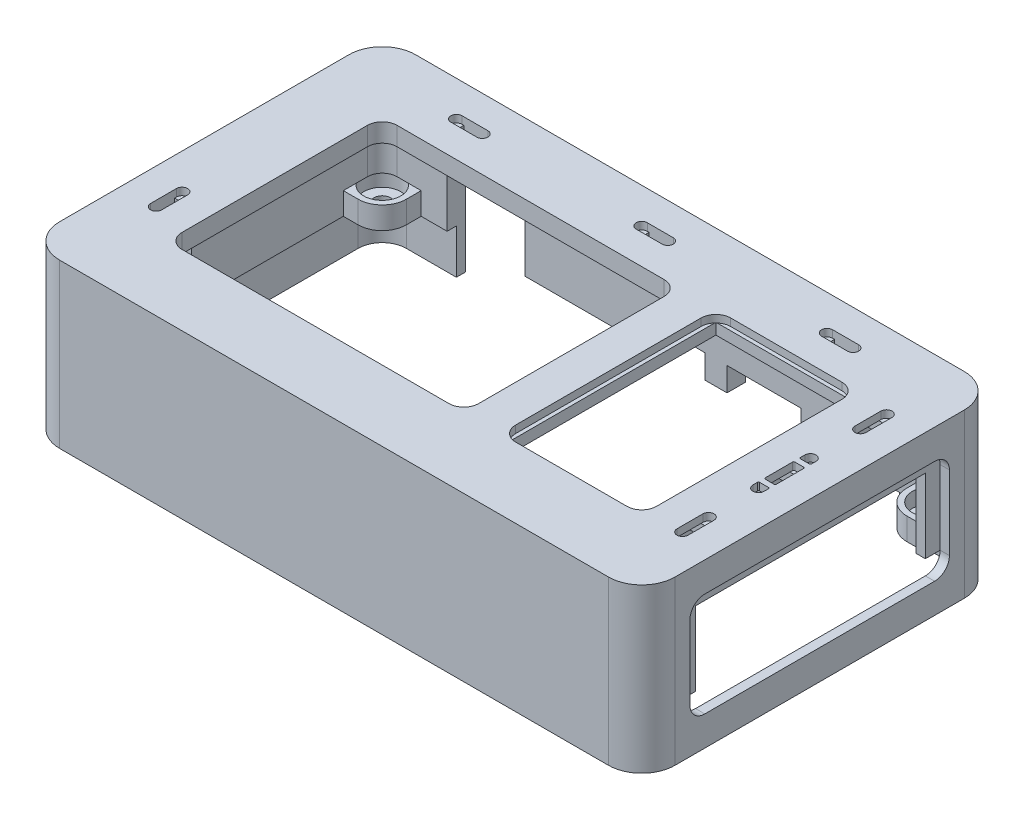
from build123d import *

# Parameters (mm, degrees)
EXTRUDE_1_DEPTH      = 22
CUT_EXTRUDE_1_DEPTH  = 19.5
CUT_EXTRUDE_2_DEPTH  = 1
CUT_EXTRUDE_START    = -1.5
SKETCH_6_W           = 3
SKETCH_6_H           = 3
SKETCH_6_H_2         = 2.8
CUT_EXTRUDE_6_DEPTH  = 1.5
CUT_EXTRUDE_7_REACH  = 98.377
CUT_EXTRUDE_8_DEPTH  = 1
CUT_EXTRUDE_9_REACH  = 99.109
CUT_EXTRUDE_START_2  = -6
CUT_EXTRUDE_10_DEPTH = 6
EXTRUDE_START        = -3
SKETCH_12_R          = 1.1
EXTRUDE_3_DEPTH      = 3
CUT_EXTRUDE_14_REACH = 99.649
SKETCH_17_W          = 31
SKETCH_17_H          = 10
CUT_EXTRUDE_15_DEPTH = 1.25
CUT_EXTRUDE_16_REACH = 97.898
SKETCH_20_R          = 2.5
CUT_EXTRUDE_17_DEPTH = 2
SKETCH_22_W          = 8
SKETCH_22_H          = 4
CUT_EXTRUDE_18_DEPTH = 1.25
CUT_EXTRUDE_19_REACH = 99.649
SKETCH_24_W          = 10.5
SKETCH_24_H          = 16.2
CUT_EXTRUDE_20_REACH = 97.187
SKETCH_28_W          = 3
SKETCH_28_H          = 8
EXTRUDE_7_DEPTH      = 43
SKETCH_30_W          = 1
SKETCH_30_H          = 8
EXTRUDE_8_DEPTH      = 1
CUT_EXTRUDE_START_3  = -8.5
SKETCH_31_W          = 9
SKETCH_31_H          = 3.2
CUT_EXTRUDE_21_DEPTH = 6
EXTRUDE_9_DEPTH      = 1
CUT_EXTRUDE_START_4  = -1.25
SKETCH_34_W          = 8
SKETCH_34_H          = 1
CUT_EXTRUDE_22_DEPTH = 1.25
EXTRUDE_START_2      = -16
EXTRUDE_10_DEPTH     = 12.5


# Read off the part's stored shape, not the designer's step: 凸台-拉伸10
with BuildPart() as part:
    # 草图1 → 凸台-拉伸1 (new body)
    with BuildSketch(Plane(origin=(0, 0, 0), x_dir=(1, 0, 0), z_dir=(0, 1, 0))):
        with BuildLine():
            Line((3, 1.5), (77, 1.5))
            ThreePointArc((77, 1.5), (80.181980515, 0.181980515), (81.5, -3))
            Line((81.5, -3), (81.5, -42))
            ThreePointArc((81.5, -42), (80.181980515, -45.181980515), (77, -46.5))
            Line((77, -46.5), (3, -46.5))
            ThreePointArc((3, -46.5), (-0.181980515, -45.181980515), (-1.5, -42))
            Line((-1.5, -42), (-1.5, -3))
            ThreePointArc((-1.5, -3), (-0.181980515, 0.181980515), (3, 1.5))
        make_face()
    extrude(amount=-EXTRUDE_1_DEPTH)

    # 草图2 → 切除-拉伸1 (cut)
    with BuildSketch(Plane.XZ.offset(22)):
        with BuildLine():
            Line((3, 1), (77, 1))
            ThreePointArc((77, 1), (78.414213562, 1.585786438), (79, 3))
            Line((79, 3), (79, 42))
            ThreePointArc((79, 42), (78.414213562, 43.414213562), (77, 44))
            Line((77, 44), (3, 44))
            ThreePointArc((3, 44), (1.585786438, 43.414213562), (1, 42))
            Line((1, 42), (1, 3))
            ThreePointArc((1, 3), (1.585786438, 1.585786438), (3, 1))
        make_face()
    extrude(amount=-CUT_EXTRUDE_1_DEPTH, mode=Mode.SUBTRACT)

    # 草图3 → 切除-拉伸2 (cut)
    with BuildSketch(Plane(origin=(0, 0, 0), x_dir=(1, 0, 0), z_dir=(0, 1, 0))):
        with BuildLine():
            Line((63.25, -2.5), (66.75, -2.5))
            ThreePointArc((66.75, -2.5), (67.5, -3.25), (66.75, -4))
            Line((66.75, -4), (63.25, -4))
            ThreePointArc((63.25, -4), (62.5, -3.25), (63.25, -2.5))
        make_face()
        with BuildLine():
            Line((72, -10), (72, -35))
            ThreePointArc((72, -35), (71.414213562, -36.414213562), (70, -37))
            Line((70, -37), (55, -37))
            ThreePointArc((55, -37), (53.585786438, -36.414213562), (53, -35))
            Line((53, -35), (53, -10))
            ThreePointArc((53, -10), (53.585786438, -8.585786438), (55, -8))
            Line((55, -8), (70, -8))
            ThreePointArc((70, -8), (71.414213562, -8.585786438), (72, -10))
        make_face()
        with BuildLine():
            Line((38.25, -2.5), (41.75, -2.5))
            ThreePointArc((41.75, -2.5), (42.5, -3.25), (41.75, -4))
            Line((41.75, -4), (38.25, -4))
            ThreePointArc((38.25, -4), (37.5, -3.25), (38.25, -2.5))
        make_face()
        with BuildLine():
            Line((13.25, -2.5), (16.75, -2.5))
            ThreePointArc((16.75, -2.5), (17.5, -3.25), (16.75, -4))
            Line((16.75, -4), (13.25, -4))
            ThreePointArc((13.25, -4), (12.5, -3.25), (13.25, -2.5))
        make_face()
        with BuildLine():
            Line((76, -19), (76, -19.6))
            ThreePointArc((76, -19.6), (76.043933983, -19.706066017), (76.15, -19.75))
            Line((76.15, -19.75), (77.35, -19.75))
            ThreePointArc((77.35, -19.75), (77.456066017, -19.706066017), (77.5, -19.6))
            Line((77.5, -19.6), (77.5, -19))
            ThreePointArc((77.5, -19), (76.75, -18.25), (76, -19))
        make_face()
        with BuildLine():
            Line((76, -26), (76, -25.4))
            ThreePointArc((76, -25.4), (76.043933983, -25.293933983), (76.15, -25.25))
            Line((76.15, -25.25), (77.35, -25.25))
            ThreePointArc((77.35, -25.25), (77.456066017, -25.293933983), (77.5, -25.4))
            Line((77.5, -25.4), (77.5, -26))
            ThreePointArc((77.5, -26), (76.75, -26.75), (76, -26))
        make_face()
        with BuildLine():
            Line((77.5, -8.75), (77.5, -12.25))
            ThreePointArc((77.5, -12.25), (76.75, -13), (76, -12.25))
            Line((76, -12.25), (76, -8.75))
            ThreePointArc((76, -8.75), (76.75, -8), (77.5, -8.75))
        make_face()
        with BuildLine():
            Line((77.5, -32.75), (77.5, -36.25))
            ThreePointArc((77.5, -36.25), (76.75, -37), (76, -36.25))
            Line((76, -36.25), (76, -32.75))
            ThreePointArc((76, -32.75), (76.75, -32), (77.5, -32.75))
        make_face()
        with BuildLine():
            Line((76.15, -20.5), (77.35, -20.5))
            ThreePointArc((77.35, -20.5), (77.456066017, -20.543933983), (77.5, -20.65))
            Line((77.5, -20.65), (77.5, -24.35))
            ThreePointArc((77.5, -24.35), (77.456066017, -24.456066017), (77.35, -24.5))
            Line((77.35, -24.5), (76.15, -24.5))
            ThreePointArc((76.15, -24.5), (76.043933983, -24.456066017), (76, -24.35))
            Line((76, -24.35), (76, -20.65))
            ThreePointArc((76, -20.65), (76.043933983, -20.543933983), (76.15, -20.5))
        make_face()
        with BuildLine():
            Line((4, -30.25), (4, -33.75))
            ThreePointArc((4, -33.75), (3.25, -34.5), (2.5, -33.75))
            Line((2.5, -33.75), (2.5, -30.25))
            ThreePointArc((2.5, -30.25), (3.25, -29.5), (4, -30.25))
        make_face()
    extrude(amount=-CUT_EXTRUDE_2_DEPTH, mode=Mode.SUBTRACT)

    # 草图6 → 切除-拉伸6 (cut)
    with BuildSketch(Plane.XZ.offset(2.5).offset(CUT_EXTRUDE_START)):
        Polygon((53.5, 36.5), (53.5, 8.5), (71.5, 8.5), (71.5, 36.5), (71.5, 41), (53.5, 41), align=None)
        with Locations((4, 32)):
            Rectangle(SKETCH_6_W, SKETCH_6_H)
        Polygon((13.5, 2.5), (16.5, 2.5), (16.5, 5.5), (16.5, 6.5), (13.5, 6.5), (13.5, 5.5), align=None)
        Polygon((38.5, 5.5), (38.5, 2.5), (41.5, 2.5), (41.5, 5.5), (41.5, 6.5), (38.5, 6.5), align=None)
        Polygon((63.5, 5.5), (63.5, 2.5), (66.5, 2.5), (66.5, 5.5), (66.5, 6.5), (63.5, 6.5), align=None)
        with Locations((76, 10.5)):
            Rectangle(SKETCH_6_W, SKETCH_6_H)
        with Locations((76, 22.5)):
            Rectangle(SKETCH_6_W, SKETCH_6_H)
        with Locations((76, 18.9)):
            Rectangle(SKETCH_6_W, SKETCH_6_H_2)
        with Locations((76, 26.1)):
            Rectangle(SKETCH_6_W, SKETCH_6_H_2)
        with Locations((76, 34.5)):
            Rectangle(SKETCH_6_W, SKETCH_6_H)
    extrude(amount=CUT_EXTRUDE_6_DEPTH, mode=Mode.SUBTRACT)

    # 草图7 → 切除-拉伸7 (cut, up to next)
    with BuildSketch(Plane(origin=(0, 0, 0), x_dir=(1, 0, 0), z_dir=(0, 1, 0)), mode=Mode.PRIVATE) as cut_extrude_7_sk1:
        with BuildLine():
            Line((10, -8), (46, -8))
            ThreePointArc((46, -8), (47.414213562, -8.585786438), (48, -10))
            Line((48, -10), (48, -35))
            ThreePointArc((48, -35), (47.414213562, -36.414213562), (46, -37))
            Line((46, -37), (10, -37))
            ThreePointArc((10, -37), (8.585786438, -36.414213562), (8, -35))
            Line((8, -35), (8, -10))
            ThreePointArc((8, -10), (8.585786438, -8.585786438), (10, -8))
        make_face()
    cut_extrude_7_tool1 = extrude(cut_extrude_7_sk1.sketch, amount=-CUT_EXTRUDE_7_REACH, mode=Mode.PRIVATE) & part.part
    add(cut_extrude_7_tool1.solids().sort_by_distance((28, 0, 22.5))[0], mode=Mode.SUBTRACT)

    # 草图8 → 切除-拉伸8 (cut)
    with BuildSketch(Plane.XZ.offset(2.5)):
        with BuildLine():
            Line((-0.25, 42), (-0.25, 3))
            ThreePointArc((-0.25, 3), (0.701902961, 0.701902961), (3, -0.25))
            Line((3, -0.25), (77, -0.25))
            ThreePointArc((77, -0.25), (79.298097039, 0.701902961), (80.25, 3))
            Line((80.25, 3), (80.25, 42))
            ThreePointArc((80.25, 42), (79.298097039, 44.298097039), (77, 45.25))
            Line((77, 45.25), (3, 45.25))
            ThreePointArc((3, 45.25), (0.701902961, 44.298097039), (-0.25, 42))
        make_face()
    extrude(amount=CUT_EXTRUDE_8_DEPTH, mode=Mode.SUBTRACT)

    # 草图10 → 切除-拉伸9 (cut, up to next)
    with BuildSketch(Plane(origin=(0, 0, -1.5), x_dir=(-1, 0, 0), z_dir=(0, 0, -1)), mode=Mode.PRIVATE) as cut_extrude_9_sk1:
        Polygon((-44.5, -16), (-44.5, -12.8), (-35.5, -12.8), (-35.5, -16), (-20.25, -16), (-20.25, -5.8), (-9.75, -5.8), (-9.75, -16), (-9.75, -22), (-69.5, -22), (-69.5, -16), (-69.5, -12.8), (-60.5, -12.8), (-60.5, -16), (-57.5, -16), (-57.5, -12.8), (-47.5, -12.8), (-47.5, -16), align=None)
    cut_extrude_9_tool1 = extrude(cut_extrude_9_sk1.sketch, amount=-CUT_EXTRUDE_9_REACH, mode=Mode.PRIVATE) & part.part
    add(cut_extrude_9_tool1.solids().sort_by_distance((36.952562, -16.695119, -1.5))[0], mode=Mode.SUBTRACT)

    # 草图11 → 切除-拉伸10 (cut)
    with BuildSketch(Plane.XZ.offset(22).offset(CUT_EXTRUDE_START_2)):
        with BuildLine():
            Line((3, -0.25), (77, -0.25))
            ThreePointArc((77, -0.25), (79.298097039, 0.701902961), (80.25, 3))
            Line((80.25, 3), (80.25, 42))
            ThreePointArc((80.25, 42), (79.298097039, 44.298097039), (77, 45.25))
            Line((77, 45.25), (3, 45.25))
            ThreePointArc((3, 45.25), (0.701902961, 44.298097039), (-0.25, 42))
            Line((-0.25, 42), (-0.25, 3))
            ThreePointArc((-0.25, 3), (0.701902961, 0.701902961), (3, -0.25))
        make_face()
    extrude(amount=CUT_EXTRUDE_10_DEPTH, mode=Mode.SUBTRACT)

    # 草图12 → 凸台-拉伸3 (add)
    # profile 1 of 4: a face of its own
    with BuildSketch(Plane.XZ.offset(16).offset(EXTRUDE_START)):
        with BuildLine():
            Line((6.25, 42), (6.25, 45.25))
            Line((6.25, 45.25), (3, 45.25))
            ThreePointArc((3, 45.25), (0.701902961, 44.298097039), (-0.25, 42))
            Line((-0.25, 42), (-0.25, 38.75))
            Line((-0.25, 38.75), (3, 38.75))
            ThreePointArc((3, 38.75), (5.298097039, 39.701902961), (6.25, 42))
        make_face()
        with Locations(Location((3, 42, 0), (0, 0, 270))):
            Circle(SKETCH_12_R, mode=Mode.SUBTRACT)
    # profile 2 of 4: a face of its own
    with BuildSketch(Plane.XZ.offset(16).offset(EXTRUDE_START)):
        with BuildLine():
            Line((3, 6.25), (-0.25, 6.25))
            Line((-0.25, 6.25), (-0.25, 3))
            ThreePointArc((-0.25, 3), (0.701902961, 0.701902961), (3, -0.25))
            Line((3, -0.25), (6.25, -0.25))
            Line((6.25, -0.25), (6.25, 3))
            ThreePointArc((6.25, 3), (5.298097039, 5.298097039), (3, 6.25))
        make_face()
        with Locations(Location((3, 3, 0), (0, 0, 270))):
            Circle(SKETCH_12_R, mode=Mode.SUBTRACT)
    # profile 3 of 4: a face of its own
    with BuildSketch(Plane.XZ.offset(16).offset(EXTRUDE_START)):
        with BuildLine():
            Line((77, 6.25), (80.25, 6.25))
            Line((80.25, 6.25), (80.25, 3))
            ThreePointArc((80.25, 3), (79.298097039, 0.701902961), (77, -0.25))
            Line((77, -0.25), (73.75, -0.25))
            Line((73.75, -0.25), (73.75, 3))
            ThreePointArc((73.75, 3), (74.701902961, 5.298097039), (77, 6.25))
        make_face()
        with Locations(Location((77, 3, 0), (0, 0, 270))):
            Circle(SKETCH_12_R, mode=Mode.SUBTRACT)
    # profile 4 of 4: a face of its own
    with BuildSketch(Plane.XZ.offset(16).offset(EXTRUDE_START)):
        with BuildLine():
            Line((73.75, 42), (73.75, 45.25))
            Line((73.75, 45.25), (77, 45.25))
            ThreePointArc((77, 45.25), (79.298097039, 44.298097039), (80.25, 42))
            Line((80.25, 42), (80.25, 38.75))
            Line((80.25, 38.75), (77, 38.75))
            ThreePointArc((77, 38.75), (74.701902961, 39.701902961), (73.75, 42))
        make_face()
        with Locations(Location((77, 42, 0), (0, 0, 270))):
            Circle(SKETCH_12_R, mode=Mode.SUBTRACT)
    extrude(amount=EXTRUDE_3_DEPTH)

    # 草图17 → 切除-拉伸14 (cut, up to next)
    with BuildSketch(Plane(origin=(81.5, 0, 0), x_dir=(0, 0, -1), z_dir=(1, 0, 0)), mode=Mode.PRIVATE) as cut_extrude_14_sk1:
        with Locations((-22.5, -11)):
            Rectangle(SKETCH_17_W, SKETCH_17_H)
    cut_extrude_14_tool1 = extrude(cut_extrude_14_sk1.sketch, amount=-CUT_EXTRUDE_14_REACH, mode=Mode.PRIVATE) & part.part
    add(cut_extrude_14_tool1.solids().sort_by_distance((81.5, -11, 22.5))[0], mode=Mode.SUBTRACT)

    # 草图18 → 切除-拉伸15 (cut)
    with BuildSketch(Plane(origin=(81.5, 0, 0), x_dir=(0, 0, -1), z_dir=(1, 0, 0))):
        with BuildLine():
            Line((-5, -16), (-5, -6))
            ThreePointArc((-5, -6), (-5.585786438, -4.585786438), (-7, -4))
            Line((-7, -4), (-38, -4))
            ThreePointArc((-38, -4), (-39.414213562, -4.585786438), (-40, -6))
            Line((-40, -6), (-40, -16))
            ThreePointArc((-40, -16), (-39.414213562, -17.414213562), (-38, -18))
            Line((-38, -18), (-7, -18))
            ThreePointArc((-7, -18), (-5.585786438, -17.414213562), (-5, -16))
        make_face()
    extrude(amount=-CUT_EXTRUDE_15_DEPTH, mode=Mode.SUBTRACT)

    # 草图19 → 切除-拉伸16 (cut, up to next)
    with BuildSketch(Plane.XY.offset(1), mode=Mode.PRIVATE) as cut_extrude_16_sk1:
        with BuildLine():
            Line((26.125, -4.25), (29.625, -4.25))
            ThreePointArc((29.625, -4.25), (30.375, -5), (29.625, -5.75))
            Line((29.625, -5.75), (26.125, -5.75))
            ThreePointArc((26.125, -5.75), (25.375, -5), (26.125, -4.25))
        make_face()
    cut_extrude_16_tool1 = extrude(cut_extrude_16_sk1.sketch, amount=-CUT_EXTRUDE_16_REACH, mode=Mode.PRIVATE) & part.part
    add(cut_extrude_16_tool1.solids().sort_by_distance((27.875, -5, 1))[0], mode=Mode.SUBTRACT)

    # 草图20 → 切除-拉伸17 (cut)
    with BuildSketch(Plane(origin=(0, -13, 0), x_dir=(1, 0, 0), z_dir=(0, 1, 0))):
        with Locations(Location((3, -3, 0), (0, 0, 270))):
            Circle(SKETCH_20_R)
        with Locations(Location((3, -42, 0), (0, 0, 270))):
            Circle(SKETCH_20_R)
        with Locations(Location((77, -3, 0), (0, 0, 270))):
            Circle(SKETCH_20_R)
        with Locations(Location((77, -42, 0), (0, 0, 270))):
            Circle(SKETCH_20_R)
    extrude(amount=-CUT_EXTRUDE_17_DEPTH, mode=Mode.SUBTRACT)

    # 草图22 → 切除-拉伸18 (cut)
    with BuildSketch(Plane.XY.offset(1)):
        with Locations((27.875, -4.5)):
            Rectangle(SKETCH_22_W, SKETCH_22_H)
    extrude(amount=-CUT_EXTRUDE_18_DEPTH, mode=Mode.SUBTRACT)

    # 草图24 → 切除-拉伸19 (cut, up to next)
    with BuildSketch(Plane.ZY.offset(1.5), mode=Mode.PRIVATE) as cut_extrude_19_sk1:
        with Locations((32, -13.9)):
            Rectangle(SKETCH_24_W, SKETCH_24_H)
    cut_extrude_19_tool1 = extrude(cut_extrude_19_sk1.sketch, amount=-CUT_EXTRUDE_19_REACH, mode=Mode.PRIVATE) & part.part
    add(cut_extrude_19_tool1.solids().sort_by_distance((-1.5, -13.9, 32))[0], mode=Mode.SUBTRACT)

    # 草图25 → 切除-拉伸20 (cut, up to next)
    with BuildSketch(Plane.XZ.offset(16), mode=Mode.PRIVATE) as cut_extrude_20_sk1:
        Polygon((73.75, 44), (69.25, 44), (69.25, 45.25), (72.5, 45.25), align=None)
    cut_extrude_20_tool1 = extrude(cut_extrude_20_sk1.sketch, amount=-CUT_EXTRUDE_20_REACH, mode=Mode.PRIVATE) & part.part
    add(cut_extrude_20_tool1.solids().sort_by_distance((71.204301, -16, 44.591398))[0], mode=Mode.SUBTRACT)

    # 草图28 → 凸台-拉伸7 (add)
    with BuildSketch(Plane(origin=(0, 0, 44), x_dir=(-1, 0, 0), z_dir=(0, 0, -1))):
        with Locations((-67.75, -11)):
            Rectangle(SKETCH_28_W, SKETCH_28_H)
    extrude(amount=EXTRUDE_7_DEPTH)

    # 草图30 → 凸台-拉伸8 (add)
    with BuildSketch(Plane(origin=(69.25, 0, 0), x_dir=(0, 0, -1), z_dir=(1, 0, 0))):
        with Locations((-7.5, -11)):
            Rectangle(SKETCH_30_W, SKETCH_30_H)
    extrude(amount=EXTRUDE_8_DEPTH)

    # 草图31 → 切除-拉伸21 (cut)
    with BuildSketch(Plane(origin=(0, 0, -1.5), x_dir=(-1, 0, 0), z_dir=(0, 0, -1)).offset(CUT_EXTRUDE_START_3)):
        with Locations((-65, -14.4)):
            Rectangle(SKETCH_31_W, SKETCH_31_H)
    extrude(amount=CUT_EXTRUDE_21_DEPTH, mode=Mode.SUBTRACT)

    # 草图33 → 凸台-拉伸9 (add)
    with BuildSketch(Plane.XZ.offset(2.5)):
        with BuildLine():
            Line((3, -0.25), (77, -0.25))
            ThreePointArc((77, -0.25), (79.298097039, 0.701902961), (80.25, 3))
            Line((80.25, 3), (80.25, 42))
            ThreePointArc((80.25, 42), (79.298097039, 44.298097039), (77, 45.25))
            Line((77, 45.25), (3, 45.25))
            ThreePointArc((3, 45.25), (0.701902961, 44.298097039), (-0.25, 42))
            Line((-0.25, 42), (-0.25, 3))
            ThreePointArc((-0.25, 3), (0.701902961, 0.701902961), (3, -0.25))
        make_face()
        with BuildLine():
            Line((3, 1), (77, 1))
            ThreePointArc((77, 1), (78.414213562, 1.585786438), (79, 3))
            Line((79, 3), (79, 42))
            ThreePointArc((79, 42), (78.414213562, 43.414213562), (77, 44))
            Line((77, 44), (3, 44))
            ThreePointArc((3, 44), (1.585786438, 43.414213562), (1, 42))
            Line((1, 42), (1, 3))
            ThreePointArc((1, 3), (1.585786438, 1.585786438), (3, 1))
        make_face(mode=Mode.SUBTRACT)
    extrude(amount=EXTRUDE_9_DEPTH)

    # 草图34 → 切除-拉伸22 (cut)
    with BuildSketch(Plane.XY.offset(1).offset(CUT_EXTRUDE_START_4)):
        with Locations((27.875, -3)):
            Rectangle(SKETCH_34_W, SKETCH_34_H)
    extrude(amount=CUT_EXTRUDE_22_DEPTH, mode=Mode.SUBTRACT)

    # 凸台-拉伸10 outline → 凸台-拉伸10 (add)
    with BuildSketch(Plane(origin=(0, 0, 0), x_dir=(1, 0, 0), z_dir=(0, 1, 0)).offset(EXTRUDE_START_2)):
        Polygon((73.75, -44), (69.25, -44), (69.25, -45.25), (72.5, -45.25), align=None)
    extrude(amount=EXTRUDE_10_DEPTH)


solid = part.part
